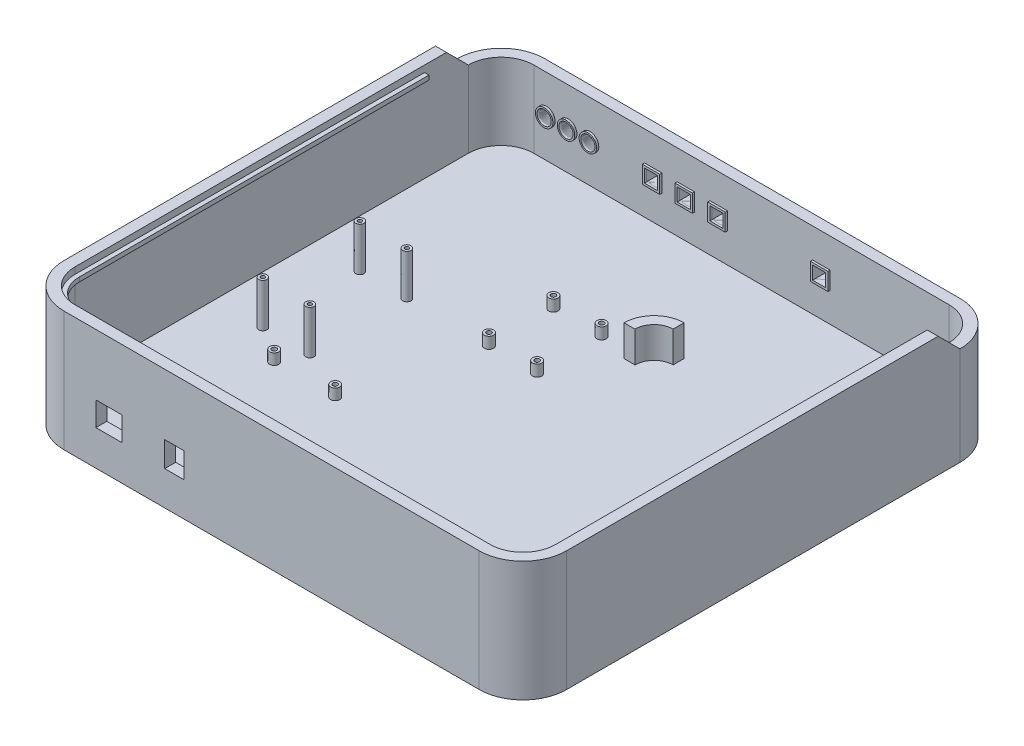
from build123d import *

# Parameters (mm, degrees)
BOSS_EXTRU_1_DEPTH                = 45
BOSS_EXTRU_1_DEPTH_BACK           = 5
COQUE2_T                          = 5
FIXATIONS_BATTERIE_12V_DEPTH      = 14.2
FIXATIONS_BATTERIE_12V_2_DEPTH    = 14.2
MODULE_WIFI_R                     = 1.875
MODULE_WIFI_R_2                   = 1.375
MODULE_WIFI_R_3                   = 0.875
INSERTS_MODULE_WIFI_DEPTH         = 20
RELAI_5V_R                        = 1.6
RELAI_5V_R_2                      = 1.102718953
INSERTS_RELAI_DEPTH               = 5.2
BATTERY_9V_R                      = 1.167497876
BATTERY_9V_R_2                    = 0.679581055
BATTERY_9V_R_3                    = 0.194582979
INSERTS_BATTERIE_9V_DEPTH         = 4.5
ARDUINO_SKETCH_R                  = 2.1
ARDUINO_SKETCH_R_2                = 1.6
ARDUINO_SKETCH_R_3                = 1.100535431
ARDUINO_SKETCH_R_4                = 1.1
ARDUINO_SKETCH_R_5                = 1.097252716
ARDUINO_SKETCH_R_6                = 1.102873252
INSERTS_ARDUINO_DEPTH             = 5
EXTRUSION_DEL_ARRIERE_DEPTH       = 5
ESQUISSE21_R                      = 3.25
EXTRUSION_DEL_AVANT_DEPTH         = 5
ESQUISSE21_9_W                    = 6
ESQUISSE21_9_H                    = 6
CONTOURS_JACK_DEPTH               = 5
EXTRUSION_FACE_AVANT_DEPTH        = 1
EXTRUSION_FACE_AVANT_DEPTH_BACK   = 6
ESQUISSE21_10_R                   = 4
ESQUISSE21_10_R_2                 = 3.25
EXTRUSION_FACE_AVANT_2_DEPTH      = 1
EXTRUSION_FACE_AVANT_2_DEPTH_BACK = 6
EXTRUSION_FACE_AVANT_3_DEPTH      = 1
EXTRUSION_FACE_AVANT_3_DEPTH_BACK = 6
EXTRUSION_FACE_AVANT_4_DEPTH      = 1
EXTRUSION_FACE_AVANT_4_DEPTH_BACK = 6
ESQUISSE21_10_W                   = 8
ESQUISSE21_10_H                   = 8
ESQUISSE21_10_W_2                 = 6
ESQUISSE21_10_H_2                 = 6
EXTRUSION_FACE_AVANT_5_DEPTH      = 1
EXTRUSION_FACE_AVANT_5_DEPTH_BACK = 6
EXTRUSION_FACE_AVANT_6_DEPTH      = 1
EXTRUSION_FACE_AVANT_6_DEPTH_BACK = 6
EXTRUSION_FACE_AVANT_7_DEPTH      = 1
EXTRUSION_FACE_AVANT_7_DEPTH_BACK = 6
ESQUISSE21_13_W                   = 6
ESQUISSE21_13_H                   = 6
EXTRUSION_JACK_POMPE_DEPTH        = 11
EXTRUSION_SOL_DEPTH               = 5
ESQUISSE25_W                      = 230.656922239
ESQUISSE25_H                      = 81.462187615
BOITIER_D_COUPAGE_FRONTAL_DEPTH   = 11
BOSS_EXTRU_18_DEPTH               = 2
CHANFREIN_START                   = 110.967262737
CHANFREIN_TOP_GAUCHE_OUTLINE_W    = 5
CHANFREIN_TOP_GAUCHE_OUTLINE_H    = 14.142135624
CHANFREIN_TOP_GAUCHE_DEPTH        = 8.032737263
CHANFREIN_TOP_DROIT_OUTLINE_W     = 5
CHANFREIN_TOP_DROIT_OUTLINE_H     = 14.142135624
CHANFREIN_TOP_DROIT_DEPTH         = 8.032737263


with BuildPart() as part:
    # coque externe → Boss.-Extru.1 (new, two sides: drawn at the far end of the back side and taken through both)
    with BuildSketch(Plane(origin=(0, 0, 0), x_dir=(1, 0, 0), z_dir=(0, 1, 0)).offset(-BOSS_EXTRU_1_DEPTH_BACK)):
        with BuildLine():
            Line((-104.440433213, 121.931407942), (-104.440433213, -58.068592058))
            ThreePointArc((-104.440433213, -58.068592058), (-100.047034931, -68.675193776), (-89.440433213, -73.068592058))
            Line((-89.440433213, -73.068592058), (100.559566787, -73.068592058))
            ThreePointArc((100.559566787, -73.068592058), (111.166168505, -68.675193776), (115.559566787, -58.068592058))
            Line((115.559566787, -58.068592058), (115.559566787, 121.931407942))
            ThreePointArc((115.559566787, 121.931407942), (111.166168505, 132.53800966), (100.559566787, 136.931407942))
            Line((100.559566787, 136.931407942), (-89.440433213, 136.931407942))
            ThreePointArc((-89.440433213, 136.931407942), (-100.047034931, 132.53800966), (-104.440433213, 121.931407942))
        make_face()
    extrude(amount=BOSS_EXTRU_1_DEPTH + BOSS_EXTRU_1_DEPTH_BACK)

    # Coque2
    coque2_openings = [part.faces().sort_by_distance(p)[0] for p in [
        (5.559566787, 45, -31.931407942),
    ]]
    offset(amount=COQUE2_T, openings=coque2_openings, kind=Kind.INTERSECTION)

    # Esquisse17 → Extrusion del arriere (cut)
    with BuildSketch(Plane(origin=(0, 0, 73.068592058), x_dir=(-1, 0, 0), z_dir=(0, 0, -1))):
        with BuildLine():
            Line((74.840433213, 6.1), (74.840433213, 8.6))
            Line((74.840433213, 8.6), (74.840433213, 16.6))
            ThreePointArc((74.840433213, 16.6), (74.693986604, 16.953553391), (74.340433213, 17.1))
            Line((74.340433213, 17.1), (63.340433213, 17.1))
            ThreePointArc((63.340433213, 17.1), (62.986879822, 16.953553391), (62.840433213, 16.6))
            Line((62.840433213, 16.6), (62.840433213, 7.1))
            Line((62.840433213, 7.1), (62.840433213, 6.6))
            Line((62.840433213, 6.6), (62.840433213, 6.1))
            Line((62.840433213, 6.1), (62.991727866, 6.1))
            Line((62.991727866, 6.1), (74.840433213, 6.1))
        make_face()
        Polygon((34.440433213, 5.6), (43.340433213, 5.6), (43.340433213, 6.6), (43.340433213, 17.1), (34.440433213, 17.1), (34.440433213, 14.6), align=None)
    extrude(amount=-EXTRUSION_DEL_ARRIERE_DEPTH, mode=Mode.SUBTRACT)

    # Esquisse21 → Extrusion del avant (cut)
    with BuildSketch(Plane(origin=(0, 0, -141.931407942), x_dir=(-1, 0, 0), z_dir=(0, 0, -1))):
        with Locations((83.728483512, 17.5)):
            Circle(ESQUISSE21_R)
        with Locations((73.728483512, 17.5)):
            Circle(ESQUISSE21_R)
        with Locations((63.728483512, 17.5)):
            Circle(ESQUISSE21_R)
    extrude(amount=-EXTRUSION_DEL_AVANT_DEPTH, mode=Mode.SUBTRACT)

    # Esquisse21<9> → Contours Jack (cut)
    with BuildSketch(Plane(origin=(0, 0, -141.931407942), x_dir=(-1, 0, 0), z_dir=(0, 0, -1))):
        with Locations((34.837391364, 17.5)):
            Rectangle(ESQUISSE21_9_W, ESQUISSE21_9_H)
        with Locations((19.856363742, 17.5)):
            Rectangle(ESQUISSE21_9_W, ESQUISSE21_9_H)
        with Locations((4.87533612, 17.5)):
            Rectangle(ESQUISSE21_9_W, ESQUISSE21_9_H)
    extrude(amount=-CONTOURS_JACK_DEPTH, mode=Mode.SUBTRACT)

    # Esquisse21<13> → Extrusion jack pompe (cut)
    with BuildSketch(Plane(origin=(0, 0, -141.931407942), x_dir=(-1, 0, 0), z_dir=(0, 0, -1))):
        with Locations((-42.12466388, 17.5)):
            Rectangle(ESQUISSE21_13_W, ESQUISSE21_13_H)
    extrude(amount=-EXTRUSION_JACK_POMPE_DEPTH, mode=Mode.SUBTRACT)



with BuildPart() as body_2:
    # battery 12V → fixations batterie 12V (new body)
    with BuildSketch(Plane(origin=(0, 0, 0), x_dir=(-1, 0, 0), z_dir=(0, 1, 0))):
        with BuildLine():
            ThreePointArc((-26.274566787, -84.931407942), (-20.112131189, -82.37884354), (-17.559566787, -76.216407942))
            Line((-17.559566787, -76.216407942), (-12.559566787, -76.216407942))
            ThreePointArc((-12.559566787, -76.216407942), (-16.576597283, -85.914377446), (-26.274566787, -89.931407942))
            Line((-26.274566787, -89.931407942), (-26.274566787, -84.931407942))
        make_face()
    extrude(amount=FIXATIONS_BATTERIE_12V_DEPTH)


with BuildPart() as body_3:
    # battery 12V → fixations batterie 12V 2 (new body)
    with BuildSketch(Plane(origin=(0, 0, 0), x_dir=(-1, 0, 0), z_dir=(0, 1, 0))):
        with BuildLine():
            ThreePointArc((-99.844566787, 66.068592058), (-106.007002385, 63.516027656), (-108.559566787, 57.353592058))
            Line((-108.559566787, 57.353592058), (-113.559566787, 57.353592058))
            ThreePointArc((-113.559566787, 57.353592058), (-109.542536291, 67.051561562), (-99.844566787, 71.068592058))
            Line((-99.844566787, 71.068592058), (-99.844566787, 66.068592058))
        make_face()
    extrude(amount=FIXATIONS_BATTERIE_12V_2_DEPTH)


with BuildPart() as body_4:
    # Module Wifi → Inserts module wifi (new body)
    # profile 1 of 8: a face of its own
    with BuildSketch(Plane(origin=(0, 0, 0), x_dir=(1, 0, 0), z_dir=(0, 1, 0))):
        with Locations(Location((-82.398224582, 5.894456898, 0), (0, 0, 270))):
            Circle(MODULE_WIFI_R)
        with Locations((-82.398224582, 5.894456898)):
            Circle(MODULE_WIFI_R_2, mode=Mode.SUBTRACT)
    # profile 2 of 8: a face of its own
    with BuildSketch(Plane(origin=(0, 0, 0), x_dir=(1, 0, 0), z_dir=(0, 1, 0))):
        with Locations((-82.398224582, 5.894456898)):
            Circle(MODULE_WIFI_R_2)
        with Locations(Location((-82.398224582, 5.894456898, 0), (0, 0, 270))):
            Circle(MODULE_WIFI_R_3, mode=Mode.SUBTRACT)
    # profile 3 of 8: a face of its own
    with BuildSketch(Plane(origin=(0, 0, 0), x_dir=(1, 0, 0), z_dir=(0, 1, 0))):
        with Locations(Location((-60.940433213, 5.931407942, 0), (0, 0, 270))):
            Circle(MODULE_WIFI_R)
        with Locations((-60.940433213, 5.931407942)):
            Circle(MODULE_WIFI_R_2, mode=Mode.SUBTRACT)
    # profile 4 of 8: a face of its own
    with BuildSketch(Plane(origin=(0, 0, 0), x_dir=(1, 0, 0), z_dir=(0, 1, 0))):
        with Locations((-60.940433213, 5.931407942)):
            Circle(MODULE_WIFI_R_2)
        with Locations(Location((-60.940433213, 5.931407942, 0), (0, 0, 270))):
            Circle(MODULE_WIFI_R_3, mode=Mode.SUBTRACT)
    # profile 5 of 8: a face of its own
    with BuildSketch(Plane(origin=(0, 0, 0), x_dir=(1, 0, 0), z_dir=(0, 1, 0))):
        with Locations(Location((-60.940433213, 50.331407942, 0), (0, 0, 270))):
            Circle(MODULE_WIFI_R)
        with Locations((-60.940433213, 50.331407942)):
            Circle(MODULE_WIFI_R_2, mode=Mode.SUBTRACT)
    # profile 6 of 8: a face of its own
    with BuildSketch(Plane(origin=(0, 0, 0), x_dir=(1, 0, 0), z_dir=(0, 1, 0))):
        with Locations((-60.940433213, 50.331407942)):
            Circle(MODULE_WIFI_R_2)
        with Locations(Location((-60.940433213, 50.331407942, 0), (0, 0, 270))):
            Circle(MODULE_WIFI_R_3, mode=Mode.SUBTRACT)
    # profile 7 of 8: a face of its own
    with BuildSketch(Plane(origin=(0, 0, 0), x_dir=(1, 0, 0), z_dir=(0, 1, 0))):
        with Locations(Location((-82.440433213, 50.331407942, 0), (0, 0, 270))):
            Circle(MODULE_WIFI_R)
        with Locations((-82.440433213, 50.331407942)):
            Circle(MODULE_WIFI_R_2, mode=Mode.SUBTRACT)
    # profile 8 of 8: a face of its own
    with BuildSketch(Plane(origin=(0, 0, 0), x_dir=(1, 0, 0), z_dir=(0, 1, 0))):
        with Locations((-82.440433213, 50.331407942)):
            Circle(MODULE_WIFI_R_2)
        with Locations(Location((-82.440433213, 50.331407942, 0), (0, 0, 270))):
            Circle(MODULE_WIFI_R_3, mode=Mode.SUBTRACT)
    extrude(amount=INSERTS_MODULE_WIFI_DEPTH)


with BuildPart() as body_5:
    # Relai 5V → Inserts Relai (new body)
    # profile 1 of 16: a face of its own
    with BuildSketch(Plane(origin=(0, 0, 0), x_dir=(-1, 0, 0), z_dir=(0, 1, 0))):
        with BuildLine():
            Line((0.800120789, -81.931407942), (2.080745637, -81.931407942))
            ThreePointArc((2.080745637, -81.931407942), (3.136702073, -81.169419233), (3.540433213, -79.931407942))
            ThreePointArc((3.540433213, -79.931407942), (1.764470248, -77.85655855), (-0.559566787, -79.291095518))
            Line((-0.559566787, -79.291095518), (-0.559566787, -80.571720366))
            ThreePointArc((-0.559566787, -80.571720366), (-0.044491027, -81.416332183), (0.800120789, -81.931407942))
        make_face()
        with Locations((1.440433213, -79.931407942)):
            Circle(RELAI_5V_R, mode=Mode.SUBTRACT)
    # profile 2 of 16: a face of its own
    with BuildSketch(Plane(origin=(0, 0, 0), x_dir=(-1, 0, 0), z_dir=(0, 1, 0))):
        with Locations((1.440433213, -79.931407942)):
            Circle(RELAI_5V_R)
        with Locations(Location((1.440433213, -79.931407942, 0), (0, 0, 90))):
            Circle(RELAI_5V_R_2, mode=Mode.SUBTRACT)
    # profile 3 of 16: a face of its own
    with BuildSketch(Plane(origin=(0, 0, 0), x_dir=(-1, 0, 0), z_dir=(0, 1, 0))):
        with BuildLine():
            Line((25.490433213, -80.571720366), (25.490433213, -79.291095518))
            ThreePointArc((25.490433213, -79.291095518), (22.005508973, -78.446483702), (22.850120789, -81.931407942))
            Line((22.850120789, -81.931407942), (24.130745637, -81.931407942))
            ThreePointArc((24.130745637, -81.931407942), (24.975357453, -81.416332183), (25.490433213, -80.571720366))
        make_face()
        with Locations((23.490433213, -79.931407942)):
            Circle(RELAI_5V_R, mode=Mode.SUBTRACT)
    # profile 4 of 16: a face of its own
    with BuildSketch(Plane(origin=(0, 0, 0), x_dir=(-1, 0, 0), z_dir=(0, 1, 0))):
        with Locations((23.490433213, -79.931407942)):
            Circle(RELAI_5V_R)
        with Locations(Location((23.490433213, -79.931407942, 0), (0, 0, 90))):
            Circle(RELAI_5V_R_2, mode=Mode.SUBTRACT)
    # profile 5 of 16: a face of its own
    with BuildSketch(Plane(origin=(0, 0, 0), x_dir=(-1, 0, 0), z_dir=(0, 1, 0))):
        with BuildLine():
            Line((25.490433213, -51.071720366), (25.490433213, -49.791095518))
            ThreePointArc((25.490433213, -49.791095518), (24.975357453, -48.946483702), (24.130745637, -48.431407942))
            Line((24.130745637, -48.431407942), (22.850120789, -48.431407942))
            ThreePointArc((22.850120789, -48.431407942), (22.005508973, -51.916332183), (25.490433213, -51.071720366))
        make_face()
        with Locations((23.490433213, -50.431407942)):
            Circle(RELAI_5V_R, mode=Mode.SUBTRACT)
    # profile 6 of 16: a face of its own
    with BuildSketch(Plane(origin=(0, 0, 0), x_dir=(-1, 0, 0), z_dir=(0, 1, 0))):
        with Locations((23.490433213, -50.431407942)):
            Circle(RELAI_5V_R)
        with Locations(Location((23.490433213, -50.431407942, 0), (0, 0, 90))):
            Circle(RELAI_5V_R_2, mode=Mode.SUBTRACT)
    # profile 7 of 16: a face of its own
    with BuildSketch(Plane(origin=(0, 0, 0), x_dir=(-1, 0, 0), z_dir=(0, 1, 0))):
        with BuildLine():
            ThreePointArc((3.540433213, -50.431407942), (3.136702073, -49.193396652), (2.080745637, -48.431407942))
            Line((2.080745637, -48.431407942), (0.800120789, -48.431407942))
            ThreePointArc((0.800120789, -48.431407942), (-0.044491027, -48.946483702), (-0.559566787, -49.791095518))
            Line((-0.559566787, -49.791095518), (-0.559566787, -51.071720366))
            ThreePointArc((-0.559566787, -51.071720366), (1.764470248, -52.506257334), (3.540433213, -50.431407942))
        make_face()
        with Locations((1.440433213, -50.431407942)):
            Circle(RELAI_5V_R, mode=Mode.SUBTRACT)
    # profile 8 of 16: a face of its own
    with BuildSketch(Plane(origin=(0, 0, 0), x_dir=(-1, 0, 0), z_dir=(0, 1, 0))):
        with Locations((1.440433213, -50.431407942)):
            Circle(RELAI_5V_R)
        with Locations(Location((1.440433213, -50.431407942, 0), (0, 0, 90))):
            Circle(RELAI_5V_R_2, mode=Mode.SUBTRACT)
    # profile 9 of 16: a face of its own
    with BuildSketch(Plane(origin=(0, 0, 0), x_dir=(-1, 0, 0), z_dir=(0, 1, 0))):
        with BuildLine():
            Line((-0.559566787, -80.571720366), (-0.559566787, -79.291095518))
            ThreePointArc((-0.559566787, -79.291095518), (-0.659566787, -79.931407942), (-0.559566787, -80.571720366))
        make_face()
    # profile 10 of 16: a face of its own
    with BuildSketch(Plane(origin=(0, 0, 0), x_dir=(-1, 0, 0), z_dir=(0, 1, 0))):
        with BuildLine():
            ThreePointArc((0.800120789, -81.931407942), (1.440433213, -82.031407942), (2.080745637, -81.931407942))
            Line((2.080745637, -81.931407942), (0.800120789, -81.931407942))
        make_face()
    # profile 11 of 16: a face of its own
    with BuildSketch(Plane(origin=(0, 0, 0), x_dir=(-1, 0, 0), z_dir=(0, 1, 0))):
        with BuildLine():
            ThreePointArc((25.590433213, -79.931407942), (25.565282605, -79.607370907), (25.490433213, -79.291095518))
            Line((25.490433213, -79.291095518), (25.490433213, -80.571720366))
            ThreePointArc((25.490433213, -80.571720366), (25.565282605, -80.255444977), (25.590433213, -79.931407942))
        make_face()
    # profile 12 of 16: a face of its own
    with BuildSketch(Plane(origin=(0, 0, 0), x_dir=(-1, 0, 0), z_dir=(0, 1, 0))):
        with BuildLine():
            Line((24.130745637, -81.931407942), (22.850120789, -81.931407942))
            ThreePointArc((22.850120789, -81.931407942), (23.490433213, -82.031407942), (24.130745637, -81.931407942))
        make_face()
    # profile 13 of 16: a face of its own
    with BuildSketch(Plane(origin=(0, 0, 0), x_dir=(-1, 0, 0), z_dir=(0, 1, 0))):
        with BuildLine():
            ThreePointArc((25.590433213, -50.431407942), (25.565282605, -50.107370907), (25.490433213, -49.791095518))
            Line((25.490433213, -49.791095518), (25.490433213, -51.071720366))
            ThreePointArc((25.490433213, -51.071720366), (25.565282605, -50.755444977), (25.590433213, -50.431407942))
        make_face()
    # profile 14 of 16: a face of its own
    with BuildSketch(Plane(origin=(0, 0, 0), x_dir=(-1, 0, 0), z_dir=(0, 1, 0))):
        with BuildLine():
            Line((22.850120789, -48.431407942), (24.130745637, -48.431407942))
            ThreePointArc((24.130745637, -48.431407942), (23.490433213, -48.331407942), (22.850120789, -48.431407942))
        make_face()
    # profile 15 of 16: a face of its own
    with BuildSketch(Plane(origin=(0, 0, 0), x_dir=(-1, 0, 0), z_dir=(0, 1, 0))):
        with BuildLine():
            Line((-0.559566787, -51.071720366), (-0.559566787, -49.791095518))
            ThreePointArc((-0.559566787, -49.791095518), (-0.659566787, -50.431407942), (-0.559566787, -51.071720366))
        make_face()
    # profile 16 of 16: a face of its own
    with BuildSketch(Plane(origin=(0, 0, 0), x_dir=(-1, 0, 0), z_dir=(0, 1, 0))):
        with BuildLine():
            Line((0.800120789, -48.431407942), (2.080745637, -48.431407942))
            ThreePointArc((2.080745637, -48.431407942), (1.440433213, -48.331407942), (0.800120789, -48.431407942))
        make_face()
    extrude(amount=INSERTS_RELAI_DEPTH)


with BuildPart() as body_6:
    # battery 9V → Inserts batterie 9V (new body)
    # profile 1 of 4: a face of its own
    with BuildSketch(Plane(origin=(0, 0, 0), x_dir=(1, 0, 0), z_dir=(0, 1, 0))):
        with Locations(Location((-13.582829551, -48.772255874, 0), (0, 0, 270))):
            Circle(BATTERY_9V_R)
        with Locations((-13.582829551, -48.772255874)):
            Circle(BATTERY_9V_R_2, mode=Mode.SUBTRACT)
    # profile 2 of 4: a face of its own
    with BuildSketch(Plane(origin=(0, 0, 0), x_dir=(1, 0, 0), z_dir=(0, 1, 0))):
        with Locations((-13.582829551, -48.772255874)):
            Circle(BATTERY_9V_R_2)
        with Locations(Location((-13.582829551, -48.772255874, 0), (0, 0, 270))):
            Circle(BATTERY_9V_R_3, mode=Mode.SUBTRACT)
    # profile 3 of 4: a face of its own
    with BuildSketch(Plane(origin=(0, 0, 0), x_dir=(1, 0, 0), z_dir=(0, 1, 0))):
        with Locations(Location((7.82129817, -35.637904773, 0), (0, 0, 270))):
            Circle(BATTERY_9V_R)
        with Locations((7.82129817, -35.637904773)):
            Circle(BATTERY_9V_R_2, mode=Mode.SUBTRACT)
    # profile 4 of 4: a face of its own
    with BuildSketch(Plane(origin=(0, 0, 0), x_dir=(1, 0, 0), z_dir=(0, 1, 0))):
        with Locations((7.82129817, -35.637904773)):
            Circle(BATTERY_9V_R_2)
        with Locations(Location((7.82129817, -35.637904773, 0), (0, 0, 270))):
            Circle(BATTERY_9V_R_3, mode=Mode.SUBTRACT)
    extrude(amount=INSERTS_BATTERIE_9V_DEPTH)


with BuildPart() as body_7:
    # Arduino Sketch → Inserts arduino (new body)
    # profile 1 of 8: a face of its own
    with BuildSketch(Plane(origin=(-115.580866426, 0, -79.737184116), x_dir=(1, 0, 0), z_dir=(0, 1, 0))):
        with Locations(Location((49.340433213, -84.805776173, 0), (0, 0, 270))):
            Circle(ARDUINO_SKETCH_R)
        with Locations((49.340433213, -84.805776173)):
            Circle(ARDUINO_SKETCH_R_2, mode=Mode.SUBTRACT)
    # profile 2 of 8: a face of its own
    with BuildSketch(Plane(origin=(-115.580866426, 0, -79.737184116), x_dir=(1, 0, 0), z_dir=(0, 1, 0))):
        with Locations((49.340433213, -84.805776173)):
            Circle(ARDUINO_SKETCH_R_2)
        with Locations(Location((49.340433213, -84.805776173, 0), (0, 0, 270))):
            Circle(ARDUINO_SKETCH_R_3, mode=Mode.SUBTRACT)
    # profile 3 of 8: a face of its own
    with BuildSketch(Plane(origin=(-115.580866426, 0, -79.737184116), x_dir=(1, 0, 0), z_dir=(0, 1, 0))):
        with Locations(Location((77.240433213, -84.805776173, 0), (0, 0, 270))):
            Circle(ARDUINO_SKETCH_R)
        with Locations((77.240433213, -84.805776173)):
            Circle(ARDUINO_SKETCH_R_2, mode=Mode.SUBTRACT)
    # profile 4 of 8: a face of its own
    with BuildSketch(Plane(origin=(-115.580866426, 0, -79.737184116), x_dir=(1, 0, 0), z_dir=(0, 1, 0))):
        with Locations((77.240433213, -84.805776173)):
            Circle(ARDUINO_SKETCH_R_2)
        with Locations(Location((77.240433213, -84.805776173, 0), (0, 0, 270))):
            Circle(ARDUINO_SKETCH_R_4, mode=Mode.SUBTRACT)
    # profile 5 of 8: a face of its own
    with BuildSketch(Plane(origin=(-115.580866426, 0, -79.737184116), x_dir=(1, 0, 0), z_dir=(0, 1, 0))):
        with Locations(Location((81.940433213, -136.705776173, 0), (0, 0, 270))):
            Circle(ARDUINO_SKETCH_R)
        with Locations((81.940433213, -136.705776173)):
            Circle(ARDUINO_SKETCH_R_2, mode=Mode.SUBTRACT)
    # profile 6 of 8: a face of its own
    with BuildSketch(Plane(origin=(-115.580866426, 0, -79.737184116), x_dir=(1, 0, 0), z_dir=(0, 1, 0))):
        with Locations((81.940433213, -136.705776173)):
            Circle(ARDUINO_SKETCH_R_2)
        with Locations(Location((81.940433213, -136.705776173, 0), (0, 0, 270))):
            Circle(ARDUINO_SKETCH_R_5, mode=Mode.SUBTRACT)
    # profile 7 of 8: a face of its own
    with BuildSketch(Plane(origin=(-115.580866426, 0, -79.737184116), x_dir=(1, 0, 0), z_dir=(0, 1, 0))):
        with Locations(Location((34.140433213, -135.605776173, 0), (0, 0, 270))):
            Circle(ARDUINO_SKETCH_R)
        with Locations((34.140433213, -135.605776173)):
            Circle(ARDUINO_SKETCH_R_2, mode=Mode.SUBTRACT)
    # profile 8 of 8: a face of its own
    with BuildSketch(Plane(origin=(-115.580866426, 0, -79.737184116), x_dir=(1, 0, 0), z_dir=(0, 1, 0))):
        with Locations((34.140433213, -135.605776173)):
            Circle(ARDUINO_SKETCH_R_2)
        with Locations(Location((34.140433213, -135.605776173, 0), (0, 0, 270))):
            Circle(ARDUINO_SKETCH_R_6, mode=Mode.SUBTRACT)
    extrude(amount=INSERTS_ARDUINO_DEPTH)


with BuildPart() as body_8:
    # Esquisse21<10> → Extrusion face avant (new, two sides: drawn at the far end of the back side and taken through both)
    with BuildSketch(Plane(origin=(0, 0, -141.931407942), x_dir=(-1, 0, 0), z_dir=(0, 0, -1)).offset(-EXTRUSION_FACE_AVANT_DEPTH_BACK)):
        with Locations((83.728483512, 17.5)):
            Circle(ESQUISSE21_10_R)
        with Locations((83.728483512, 17.5)):
            Circle(ESQUISSE21_10_R_2, mode=Mode.SUBTRACT)
    extrude(amount=EXTRUSION_FACE_AVANT_DEPTH + EXTRUSION_FACE_AVANT_DEPTH_BACK)


with BuildPart() as body_9:
    # Esquisse21<10> → Extrusion face avant 2 (new, two sides: drawn at the far end of the back side and taken through both)
    with BuildSketch(Plane(origin=(0, 0, -141.931407942), x_dir=(-1, 0, 0), z_dir=(0, 0, -1)).offset(-EXTRUSION_FACE_AVANT_2_DEPTH_BACK)):
        with Locations((73.728483512, 17.5)):
            Circle(ESQUISSE21_10_R)
        with Locations((73.728483512, 17.5)):
            Circle(ESQUISSE21_10_R_2, mode=Mode.SUBTRACT)
    extrude(amount=EXTRUSION_FACE_AVANT_2_DEPTH + EXTRUSION_FACE_AVANT_2_DEPTH_BACK)


with BuildPart() as body_10:
    # Esquisse21<10> → Extrusion face avant 3 (new, two sides: drawn at the far end of the back side and taken through both)
    with BuildSketch(Plane(origin=(0, 0, -141.931407942), x_dir=(-1, 0, 0), z_dir=(0, 0, -1)).offset(-EXTRUSION_FACE_AVANT_3_DEPTH_BACK)):
        with Locations((63.728483512, 17.5)):
            Circle(ESQUISSE21_10_R)
        with Locations((63.728483512, 17.5)):
            Circle(ESQUISSE21_10_R_2, mode=Mode.SUBTRACT)
    extrude(amount=EXTRUSION_FACE_AVANT_3_DEPTH + EXTRUSION_FACE_AVANT_3_DEPTH_BACK)


with BuildPart() as body_11:
    # Esquisse21<10> → Extrusion face avant 4 (new, two sides: drawn at the far end of the back side and taken through both)
    with BuildSketch(Plane(origin=(0, 0, -141.931407942), x_dir=(-1, 0, 0), z_dir=(0, 0, -1)).offset(-EXTRUSION_FACE_AVANT_4_DEPTH_BACK)):
        with Locations((19.856363742, 17.5)):
            Rectangle(ESQUISSE21_10_W, ESQUISSE21_10_H)
        with Locations((19.856363742, 17.5)):
            Rectangle(ESQUISSE21_10_W_2, ESQUISSE21_10_H_2, mode=Mode.SUBTRACT)
    extrude(amount=EXTRUSION_FACE_AVANT_4_DEPTH + EXTRUSION_FACE_AVANT_4_DEPTH_BACK)


with BuildPart() as body_12:
    # Esquisse21<10> → Extrusion face avant 5 (new, two sides: drawn at the far end of the back side and taken through both)
    with BuildSketch(Plane(origin=(0, 0, -141.931407942), x_dir=(-1, 0, 0), z_dir=(0, 0, -1)).offset(-EXTRUSION_FACE_AVANT_5_DEPTH_BACK)):
        with Locations((34.837391364, 17.5)):
            Rectangle(ESQUISSE21_10_W, ESQUISSE21_10_H)
        with Locations((34.837391364, 17.5)):
            Rectangle(ESQUISSE21_10_W_2, ESQUISSE21_10_H_2, mode=Mode.SUBTRACT)
    extrude(amount=EXTRUSION_FACE_AVANT_5_DEPTH + EXTRUSION_FACE_AVANT_5_DEPTH_BACK)


with BuildPart() as body_13:
    # Esquisse21<10> → Extrusion face avant 6 (new, two sides: drawn at the far end of the back side and taken through both)
    with BuildSketch(Plane(origin=(0, 0, -141.931407942), x_dir=(-1, 0, 0), z_dir=(0, 0, -1)).offset(-EXTRUSION_FACE_AVANT_6_DEPTH_BACK)):
        with Locations((4.87533612, 17.5)):
            Rectangle(ESQUISSE21_10_W, ESQUISSE21_10_H)
        with Locations((4.87533612, 17.5)):
            Rectangle(ESQUISSE21_10_W_2, ESQUISSE21_10_H_2, mode=Mode.SUBTRACT)
    extrude(amount=EXTRUSION_FACE_AVANT_6_DEPTH + EXTRUSION_FACE_AVANT_6_DEPTH_BACK)


with BuildPart() as body_14:
    # Esquisse21<10> → Extrusion face avant 7 (new, two sides: drawn at the far end of the back side and taken through both)
    with BuildSketch(Plane(origin=(0, 0, -141.931407942), x_dir=(-1, 0, 0), z_dir=(0, 0, -1)).offset(-EXTRUSION_FACE_AVANT_7_DEPTH_BACK)):
        with Locations((-42.12466388, 17.5)):
            Rectangle(ESQUISSE21_10_W, ESQUISSE21_10_H)
        with Locations((-42.12466388, 17.5)):
            Rectangle(ESQUISSE21_10_W_2, ESQUISSE21_10_H_2, mode=Mode.SUBTRACT)
    extrude(amount=EXTRUSION_FACE_AVANT_7_DEPTH + EXTRUSION_FACE_AVANT_7_DEPTH_BACK)


with BuildPart() as part_1:
    add(part.part)

    add(body_2.part)  # Extrusion sol merges body 2

    add(body_3.part)  # Extrusion sol merges body 3

    add(body_4.part)  # Extrusion sol merges body 4

    add(body_5.part)  # Extrusion sol merges body 5

    add(body_6.part)  # Extrusion sol merges body 6

    add(body_7.part)  # Extrusion sol merges body 7
    # Esquisse28 → Extrusion sol (add)
    with BuildSketch(Plane(origin=(0, -5, 0), x_dir=(1, 0, 0), z_dir=(0, 1, 0))):
        with BuildLine():
            Line((120.559566787, 121.931407942), (120.559566787, -58.068592058))
            ThreePointArc((120.559566787, -58.068592058), (114.701702411, -72.210727681), (100.559566787, -78.068592058))
            Line((100.559566787, -78.068592058), (-89.440433213, -78.068592058))
            ThreePointArc((-89.440433213, -78.068592058), (-103.582568837, -72.210727681), (-109.440433213, -58.068592058))
            Line((-109.440433213, -58.068592058), (-109.440433213, 121.931407942))
            ThreePointArc((-109.440433213, 121.931407942), (-103.582568837, 136.073543566), (-89.440433213, 141.931407942))
            Line((-89.440433213, 141.931407942), (100.559566787, 141.931407942))
            ThreePointArc((100.559566787, 141.931407942), (114.701702411, 136.073543566), (120.559566787, 121.931407942))
        make_face()
    extrude(amount=EXTRUSION_SOL_DEPTH)

    # Esquisse25 → Boitier découpage frontal (cut)
    with BuildSketch(Plane(origin=(0, 35, 0), x_dir=(1, 0, 0), z_dir=(0, 1, 0))):
        with Locations((5.236736986, 162.66250175)):
            Rectangle(ESQUISSE25_W, ESQUISSE25_H)
    extrude(amount=BOITIER_D_COUPAGE_FRONTAL_DEPTH, mode=Mode.SUBTRACT)

    # Rail interieur → Boss.-Extru.18 (add)
    with BuildSketch(Plane(origin=(0, 40, 0), x_dir=(1, 0, 0), z_dir=(0, 1, 0))):
        with BuildLine():
            Line((-104.440433213, 101.931407942), (-104.440433213, -58.068592058))
            ThreePointArc((-104.440433213, -58.068592058), (-100.047034931, -68.675193776), (-89.440433213, -73.068592058))
            Line((-89.440433213, -73.068592058), (100.559566787, -73.068592058))
            ThreePointArc((100.559566787, -73.068592058), (111.166168505, -68.675193776), (115.559566787, -58.068592058))
            Line((115.559566787, -58.068592058), (115.559566787, 101.931407942))
            Line((115.559566787, 101.931407942), (113.559566787, 101.931407942))
            Line((113.559566787, 101.931407942), (113.559566787, -58.068592058))
            ThreePointArc((113.559566787, -58.068592058), (109.751954942, -67.260980213), (100.559566787, -71.068592058))
            Line((100.559566787, -71.068592058), (-89.440433213, -71.068592058))
            ThreePointArc((-89.440433213, -71.068592058), (-98.632821368, -67.260980213), (-102.440433213, -58.068592058))
            Line((-102.440433213, -58.068592058), (-102.440433213, 101.931407942))
            Line((-102.440433213, 101.931407942), (-104.440433213, 101.931407942))
        make_face()
    extrude(amount=BOSS_EXTRU_18_DEPTH)

    # Chanfrein top gauche: read off the stored shape, not the designer's step
    # Chanfrein top gauche outline → Chanfrein top gauche (cut)
    with BuildSketch(Plane(origin=(0, 0, 0), x_dir=(1, 0, 0), z_dir=(0, 0.707106781186547, -0.707106781186548)).offset(CHANFREIN_START)):
        with Locations((118.059566787, 54.398720242)):
            Rectangle(CHANFREIN_TOP_GAUCHE_OUTLINE_W, CHANFREIN_TOP_GAUCHE_OUTLINE_H)
    extrude(amount=CHANFREIN_TOP_GAUCHE_DEPTH, mode=Mode.SUBTRACT)

    # Chanfrein top droit: read off the stored shape, not the designer's step
    # Chanfrein top droit outline → Chanfrein top droit (cut)
    with BuildSketch(Plane(origin=(0, 0, 0), x_dir=(1, 0, 0), z_dir=(0, 0.707106781186547, -0.707106781186548)).offset(CHANFREIN_START)):
        with Locations((-106.940433213, 54.398720242)):
            Rectangle(CHANFREIN_TOP_DROIT_OUTLINE_W, CHANFREIN_TOP_DROIT_OUTLINE_H)
    extrude(amount=CHANFREIN_TOP_DROIT_DEPTH, mode=Mode.SUBTRACT)


solid = Compound([body_8.part, body_9.part, body_10.part, body_11.part, body_12.part, body_13.part, body_14.part, part_1.part])
